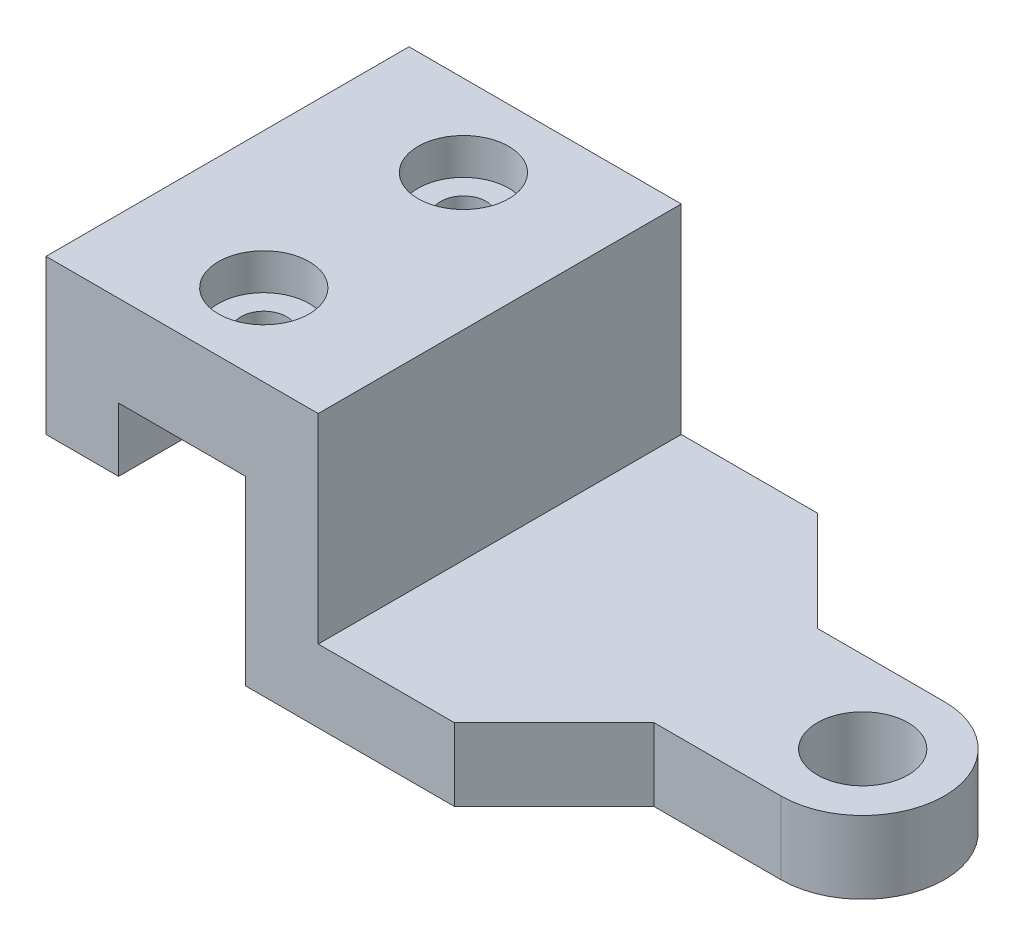
from build123d import *

# Parameters (mm, degrees)
SKETCH1_R                               = 25
BOSS_EXTRUDE1_DEPTH                     = 40
SKETCH1_3_W                             = 40
SKETCH1_3_H                             = 200
BOSS_EXTRUDE2_DEPTH                     = 150
SKETCH2_W                               = 200
SKETCH2_H                               = 50
BOSS_EXTRUDE3_DEPTH                     = 110
SKETCH3_W                               = 40
SKETCH3_H                               = 200
BOSS_EXTRUDE4_DEPTH                     = 35
CBORE_FOR_M5_HEX_HEAD_BOLT1_D           = 25
CBORE_FOR_M5_HEX_HEAD_BOLT1_CBORE_D     = 50
CBORE_FOR_M5_HEX_HEAD_BOLT1_CBORE_DEPTH = 20


with BuildPart() as part:
    # Sketch1 → Boss-Extrude1 (new body)
    with BuildSketch(Plane(origin=(0, 0, 0), x_dir=(1, 0, 0), z_dir=(0, 1, 0))):
        with BuildLine():
            Line((0, 200), (0, 0))
            Line((0, 0), (75, 0))
            Line((75, 0), (130, 55))
            Line((130, 55), (200, 55))
            ThreePointArc((200, 55), (245, 100), (200, 145))
            Line((200, 145), (130, 145))
            Line((130, 145), (75, 200))
            Line((75, 200), (0, 200))
        make_face()
        with Locations((200, 100)):
            Circle(SKETCH1_R, mode=Mode.SUBTRACT)
    extrude(amount=BOSS_EXTRUDE1_DEPTH)

    # Sketch1<3> → Boss-Extrude2 (add)
    with BuildSketch(Plane(origin=(0, 0, 0), x_dir=(1, 0, 0), z_dir=(0, 1, 0))):
        with Locations((-20, 100)):
            Rectangle(SKETCH1_3_W, SKETCH1_3_H)
    extrude(amount=BOSS_EXTRUDE2_DEPTH)

    # Sketch2 → Boss-Extrude3 (add)
    with BuildSketch(Plane.ZY.offset(40)):
        with Locations((-100, 125)):
            Rectangle(SKETCH2_W, SKETCH2_H)
    extrude(amount=BOSS_EXTRUDE3_DEPTH)

    # Sketch3 → Boss-Extrude4 (add)
    with BuildSketch(Plane.XZ.offset(-100)):
        with Locations((-130, -100)):
            Rectangle(SKETCH3_W, SKETCH3_H)
    extrude(amount=BOSS_EXTRUDE4_DEPTH)

    # CBORE for M5 Hex Head Bolt1 (through all)
    with Locations(Plane(origin=(0, 150, 0), x_dir=(1, 0, 0), z_dir=(0, 1, 0))):
        with Locations((-75, 155), (-75, 45)):
            CounterBoreHole(CBORE_FOR_M5_HEX_HEAD_BOLT1_D / 2, CBORE_FOR_M5_HEX_HEAD_BOLT1_CBORE_D / 2, CBORE_FOR_M5_HEX_HEAD_BOLT1_CBORE_DEPTH)


solid = part.part
